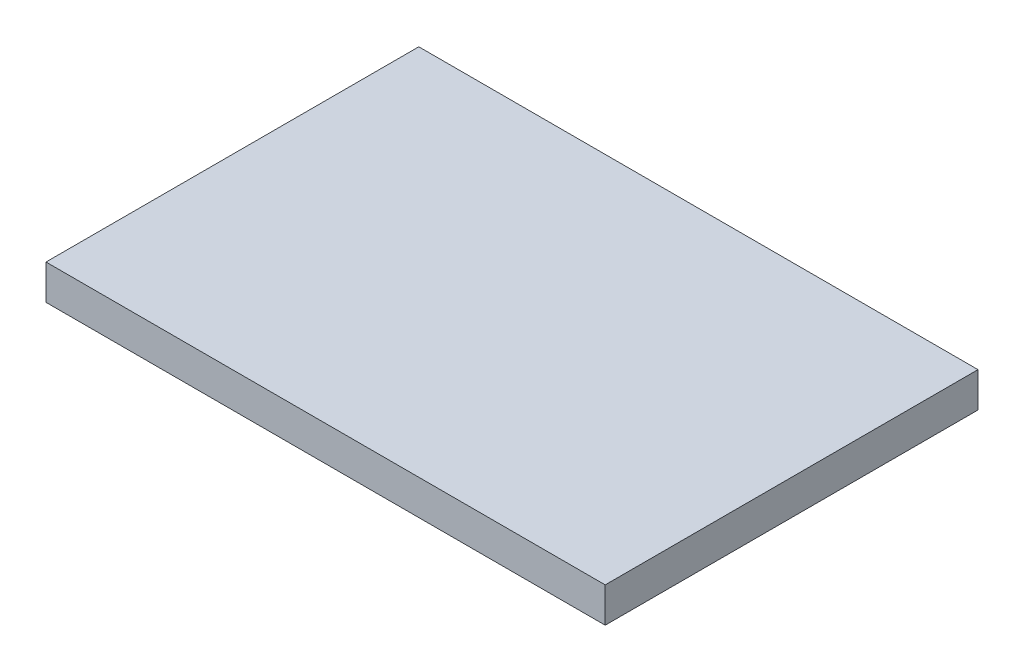
from build123d import *

# Parameters (mm, degrees)
OUTER_SHELL_EXTRUSION_DEPTH   = 9.525
SKETCH2_R                     = 1.5875
INSERTION_HOLES_DEPTH         = 3.175
WALLTHICKNESS_SHELL_START     = -73.025
WALLTHICKNESS_SHELL_OUTLINE_W = 3.175
WALLTHICKNESS_SHELL_OUTLINE_H = 95.25
WALLTHICKNESS_SHELL_DEPTH     = 146.05
CUT_EXTRUDE2_START            = 3.175
CUT_EXTRUDE2_DEPTH            = 3.175
SKETCH3_R                     = 1.27
SKETCH3_R_2                   = 1.905
SKETCH3_R_3                   = 3.175
SKETCH3_R_4                   = 6.35
SKETCH3_R_5                   = 9.525
BOSS_EXTRUDE2_DEPTH           = 3.175
FILLET1_R                     = 1


# Read off the part's stored shape, not the designer's step: WallThickness-Shell, Cut-Extrude2
with BuildPart() as part:
    # Outer_Shell → Outer_Shell_Extrusion (new body)
    with BuildSketch(Plane(origin=(0, 0, 0), x_dir=(1, 0, 0), z_dir=(0, 1, 0))):
        Polygon((66.675, 61.504285714), (76.2, 61.504285714), (76.2, 51.979285714), (76.2, 45.629285714), (76.2, 26.579285714), (76.2, 20.229285714), (76.2, 1.179285714), (76.2, -5.170714286), (76.2, -24.220714286), (76.2, -30.570714286), (76.2, -40.095714286), (66.675, -40.095714286), (60.325, -40.095714286), (41.275, -40.095714286), (34.925, -40.095714286), (15.875, -40.095714286), (9.525, -40.095714286), (-9.525, -40.095714286), (-15.875, -40.095714286), (-76.2, -40.095714286), (-76.2, 61.504285714), (-15.875, 61.504285714), (-9.525, 61.504285714), (9.525, 61.504285714), (15.875, 61.504285714), (34.925, 61.504285714), (41.275, 61.504285714), (60.325, 61.504285714), align=None)
    extrude(amount=OUTER_SHELL_EXTRUSION_DEPTH)

    # Sketch2 → Insertion_holes (cut)
    with BuildSketch(Plane.ZY.offset(76.2)):
        with Locations((-48.804285714, 4.7625)):
            Circle(SKETCH2_R)
        with Locations((-29.754285714, 4.7625)):
            Circle(SKETCH2_R)
        with Locations((-10.704285714, 4.7625)):
            Circle(SKETCH2_R)
        with Locations((8.345714286, 4.7625)):
            Circle(SKETCH2_R)
        with Locations((27.395714286, 4.7625)):
            Circle(SKETCH2_R)
    extrude(amount=-INSERTION_HOLES_DEPTH, mode=Mode.SUBTRACT)

    # WallThickness-Shell outline → WallThickness-Shell (cut)
    with BuildSketch(Plane.YZ.offset(WALLTHICKNESS_SHELL_START)):
        with Locations((4.7625, -10.704285714)):
            Rectangle(WALLTHICKNESS_SHELL_OUTLINE_W, WALLTHICKNESS_SHELL_OUTLINE_H)
    extrude(amount=WALLTHICKNESS_SHELL_DEPTH, mode=Mode.SUBTRACT)

    # Cut-Extrude2 outline → Cut-Extrude2 (cut)
    with BuildSketch(Plane(origin=(0, 0, 0), x_dir=(1, 0, 0), z_dir=(0, 1, 0)).offset(CUT_EXTRUDE2_START)):
        with BuildLine():
            Line((61.9075, 58.329285714), (65.0875, 58.329285714))
            ThreePointArc((65.0875, 58.329285714), (63.4975, 59.919285714), (61.9075, 58.329285714))
        make_face()
        with BuildLine():
            ThreePointArc((-14.3175, -36.920714286), (-12.7275, -38.510714286), (-11.1375, -36.920714286))
            Line((-11.1375, -36.920714286), (-14.3175, -36.920714286))
        make_face()
        with BuildLine():
            ThreePointArc((11.0925, -36.920714286), (12.6825, -38.510714286), (14.2725, -36.920714286))
            Line((14.2725, -36.920714286), (11.0925, -36.920714286))
        make_face()
        with BuildLine():
            ThreePointArc((36.5025, -36.920714286), (38.0925, -38.510714286), (39.6825, -36.920714286))
            Line((39.6825, -36.920714286), (36.5025, -36.920714286))
        make_face()
        with BuildLine():
            ThreePointArc((61.9075, -36.920714286), (63.4975, -38.510714286), (65.0875, -36.920714286))
            Line((65.0875, -36.920714286), (61.9075, -36.920714286))
        make_face()
        with BuildLine():
            ThreePointArc((73.025, -28.985714286), (74.615, -27.395714286), (73.025, -25.805714286))
            Line((73.025, -25.805714286), (73.025, -28.985714286))
        make_face()
        with BuildLine():
            ThreePointArc((73.025, -3.575714286), (74.615, -1.985714286), (73.025, -0.395714286))
            Line((73.025, -0.395714286), (73.025, -3.575714286))
        make_face()
        with BuildLine():
            ThreePointArc((73.025, 21.804285714), (74.615, 23.394285714), (73.025, 24.984285714))
            Line((73.025, 24.984285714), (73.025, 21.804285714))
        make_face()
        with BuildLine():
            ThreePointArc((73.025, 47.214285714), (74.615, 48.804285714), (73.025, 50.394285714))
            Line((73.025, 50.394285714), (73.025, 47.214285714))
        make_face()
        with BuildLine():
            Line((-14.3175, 58.329285714), (-11.1375, 58.329285714))
            ThreePointArc((-11.1375, 58.329285714), (-12.7275, 59.919285714), (-14.3175, 58.329285714))
        make_face()
        with BuildLine():
            Line((11.0925, 58.329285714), (14.2725, 58.329285714))
            ThreePointArc((14.2725, 58.329285714), (12.6825, 59.919285714), (11.0925, 58.329285714))
        make_face()
        with BuildLine():
            Line((36.5025, 58.329285714), (39.6825, 58.329285714))
            ThreePointArc((39.6825, 58.329285714), (38.0925, 59.919285714), (36.5025, 58.329285714))
        make_face()
    extrude(amount=CUT_EXTRUDE2_DEPTH, mode=Mode.SUBTRACT)

    # Sketch3 → Boss-Extrude2 (add)
    with BuildSketch(Plane(origin=(0, 3.175, 0), x_dir=(1, 0, 0), z_dir=(0, 1, 0))):
        with Locations(Location((-57.15, -26.760714286, 0), (0, 0, 270))):
            Circle(SKETCH3_R)
        with Locations(Location((-44.45, -26.760714286, 0), (0, 0, 270))):
            Circle(SKETCH3_R)
        with Locations(Location((-31.75, -26.760714286, 0), (0, 0, 270))):
            Circle(SKETCH3_R)
        with Locations(Location((-19.05, -26.760714286, 0), (0, 0, 270))):
            Circle(SKETCH3_R)
        with Locations(Location((-6.35, -26.760714286, 0), (0, 0, 270))):
            Circle(SKETCH3_R)
        with Locations(Location((6.35, -26.760714286, 0), (0, 0, 270))):
            Circle(SKETCH3_R)
        with Locations(Location((19.05, -26.760714286, 0), (0, 0, 270))):
            Circle(SKETCH3_R)
        with Locations(Location((31.75, -26.760714286, 0), (0, 0, 270))):
            Circle(SKETCH3_R)
        with Locations(Location((44.45, -26.760714286, 0), (0, 0, 270))):
            Circle(SKETCH3_R)
        with Locations(Location((57.15, -26.760714286, 0), (0, 0, 270))):
            Circle(SKETCH3_R)
        with Locations(Location((-57.15, -18.302514286, 0), (0, 0, 270))):
            Circle(SKETCH3_R)
        with Locations(Location((-57.15, -9.844314286, 0), (0, 0, 270))):
            Circle(SKETCH3_R)
        with Locations(Location((-57.15, -1.386114286, 0), (0, 0, 270))):
            Circle(SKETCH3_R)
        with Locations(Location((-57.15, 7.072085714, 0), (0, 0, 270))):
            Circle(SKETCH3_R)
        with Locations(Location((-57.15, 15.530285714, 0), (0, 0, 270))):
            Circle(SKETCH3_R)
        with Locations(Location((-57.15, 23.988485714, 0), (0, 0, 270))):
            Circle(SKETCH3_R)
        with Locations(Location((-57.15, 32.446685714, 0), (0, 0, 270))):
            Circle(SKETCH3_R)
        with Locations(Location((-57.15, 40.904885714, 0), (0, 0, 270))):
            Circle(SKETCH3_R)
        with Locations(Location((-44.45, -18.302514286, 0), (0, 0, 270))):
            Circle(SKETCH3_R_2)
        with Locations(Location((-34.45, -18.302514286, 0), (0, 0, 270))):
            Circle(SKETCH3_R_2)
        with Locations(Location((-24.45, -18.302514286, 0), (0, 0, 270))):
            Circle(SKETCH3_R_2)
        with Locations(Location((-14.45, -18.302514286, 0), (0, 0, 270))):
            Circle(SKETCH3_R_2)
        with Locations(Location((-4.45, -18.302514286, 0), (0, 0, 270))):
            Circle(SKETCH3_R_2)
        with Locations(Location((5.55, -18.302514286, 0), (0, 0, 270))):
            Circle(SKETCH3_R_2)
        with Locations(Location((15.55, -18.302514286, 0), (0, 0, 270))):
            Circle(SKETCH3_R_2)
        with Locations(Location((25.55, -18.302514286, 0), (0, 0, 270))):
            Circle(SKETCH3_R_2)
        with Locations(Location((35.55, -18.302514286, 0), (0, 0, 270))):
            Circle(SKETCH3_R_2)
        with Locations(Location((45.55, -18.302514286, 0), (0, 0, 270))):
            Circle(SKETCH3_R_2)
        with Locations(Location((-34.45, -8.302514286, 0), (0, 0, 270))):
            Circle(SKETCH3_R_2)
        with Locations(Location((-24.45, -8.302514286, 0), (0, 0, 270))):
            Circle(SKETCH3_R_2)
        with Locations(Location((-14.45, -8.302514286, 0), (0, 0, 270))):
            Circle(SKETCH3_R_2)
        with Locations(Location((-4.45, -8.302514286, 0), (0, 0, 270))):
            Circle(SKETCH3_R_2)
        with Locations(Location((-34.45, 1.697485714, 0), (0, 0, 270))):
            Circle(SKETCH3_R_2)
        with Locations(Location((-24.45, 1.697485714, 0), (0, 0, 270))):
            Circle(SKETCH3_R_2)
        with Locations(Location((-14.45, 1.697485714, 0), (0, 0, 270))):
            Circle(SKETCH3_R_2)
        with Locations(Location((-34.45, 11.697485714, 0), (0, 0, 270))):
            Circle(SKETCH3_R_2)
        with Locations(Location((-24.45, 11.697485714, 0), (0, 0, 270))):
            Circle(SKETCH3_R_2)
        with Locations(Location((-34.45, 21.697485714, 0), (0, 0, 270))):
            Circle(SKETCH3_R_2)
        with Locations(Location((-44.45, -8.302514286, 0), (0, 0, 270))):
            Circle(SKETCH3_R_2)
        with Locations(Location((-44.45, 1.697485714, 0), (0, 0, 270))):
            Circle(SKETCH3_R_2)
        with Locations(Location((-44.45, 11.697485714, 0), (0, 0, 270))):
            Circle(SKETCH3_R_2)
        with Locations(Location((-44.45, 21.697485714, 0), (0, 0, 270))):
            Circle(SKETCH3_R_2)
        with Locations(Location((-44.45, 31.697485714, 0), (0, 0, 270))):
            Circle(SKETCH3_R_2)
        with Locations(Location((-44.45, 41.697485714, 0), (0, 0, 270))):
            Circle(SKETCH3_R_2)
        with Locations(Location((-57.15, 50.904885714, 0), (0, 0, 270))):
            Circle(SKETCH3_R)
        with Locations(Location((-44.45, 51.697485714, 0), (0, 0, 270))):
            Circle(SKETCH3_R_2)
        with Locations(Location((55.55, -12.587514286, 0), (0, 0, 270))):
            Circle(SKETCH3_R_3)
        with Locations(Location((5.55, -8.302514286, 0), (0, 0, 270))):
            Circle(SKETCH3_R_3)
        with Locations(Location((15.55, -5.762514286, 0), (0, 0, 270))):
            Circle(SKETCH3_R_3)
        with Locations(Location((25.55, -8.302514286, 0), (0, 0, 270))):
            Circle(SKETCH3_R_3)
        with Locations(Location((35.55, -2.587514286, 0), (0, 0, 270))):
            Circle(SKETCH3_R_3)
        with Locations(Location((45.55, -8.302514286, 0), (0, 0, 270))):
            Circle(SKETCH3_R_3)
        with Locations(Location((55.55, -2.587514286, 0), (0, 0, 270))):
            Circle(SKETCH3_R_3)
        with Locations(Location((-4.45, 7.412485714, 0), (0, 0, 270))):
            Circle(SKETCH3_R_3)
        with Locations(Location((5.55, 1.697485714, 0), (0, 0, 270))):
            Circle(SKETCH3_R_3)
        with Locations(Location((15.55, 7.412485714, 0), (0, 0, 270))):
            Circle(SKETCH3_R_3)
        with Locations(Location((25.55, 1.697485714, 0), (0, 0, 270))):
            Circle(SKETCH3_R_3)
        with Locations(Location((35.55, 7.412485714, 0), (0, 0, 270))):
            Circle(SKETCH3_R_3)
        with Locations(Location((45.55, 1.697485714, 0), (0, 0, 270))):
            Circle(SKETCH3_R_3)
        with Locations(Location((55.55, 7.412485714, 0), (0, 0, 270))):
            Circle(SKETCH3_R_3)
        with Locations(Location((-14.45, 17.412485714, 0), (0, 0, 270))):
            Circle(SKETCH3_R_3)
        with Locations(Location((-4.45, 17.412485714, 0), (0, 0, 270))):
            Circle(SKETCH3_R_3)
        with Locations(Location((-24.45, 27.412485714, 0), (0, 0, 270))):
            Circle(SKETCH3_R_3)
        with Locations(Location((-14.45, 27.412485714, 0), (0, 0, 270))):
            Circle(SKETCH3_R_3)
        with Locations(Location((-34.45, 37.412485714, 0), (0, 0, 270))):
            Circle(SKETCH3_R_3)
        with Locations(Location((-24.45, 37.412485714, 0), (0, 0, 270))):
            Circle(SKETCH3_R_3)
        with Locations(Location((-34.45, 47.412485714, 0), (0, 0, 270))):
            Circle(SKETCH3_R_3)
        with Locations(Location((-6.35, 36.521863747, 0), (0, 0, 270))):
            Circle(SKETCH3_R_4)
        with Locations(Location((11.061190517, 36.521863747, 0), (0, 0, 270))):
            Circle(SKETCH3_R_4)
        with Locations(Location((7.418737671, 19.466006948, 0), (0, 0, 270))):
            Circle(SKETCH3_R_4)
        with Locations(Location((-17.559851695, 47.412485714, 0), (0, 0, 270))):
            Circle(SKETCH3_R_4)
        with Locations(Location((25.55, 19.466006948, 0), (0, 0, 270))):
            Circle(SKETCH3_R_4)
        with Locations(Location((47.318392689, 24.465357868, 0), (0, 0, 270))):
            Circle(SKETCH3_R_5)
        with Locations(Location((29.505110236, 43.291084861, 0), (0, 0, 270))):
            Circle(SKETCH3_R_5)
        with Locations(Location((57.15, 43.291084861, 0), (0, 0, 270))):
            Circle(SKETCH3_R_5)
    extrude(amount=BOSS_EXTRUDE2_DEPTH)

    # Fillet1
    fillet1_edges = [part.edges().sort_by_distance(p)[0] for p in [
        (-57.15, 6.35, 25.490714286),
        (-57.15, 3.175, 25.490714286),
        (-44.45, 6.35, 25.490714286),
        (-44.45, 3.175, 25.490714286),
        (-31.75, 6.35, 25.490714286),
        (-31.75, 3.175, 25.490714286),
        (-19.05, 6.35, 25.490714286),
        (-19.05, 3.175, 25.490714286),
        (-6.35, 6.35, 25.490714286),
        (-6.35, 3.175, 25.490714286),
        (6.35, 6.35, 25.490714286),
        (6.35, 3.175, 25.490714286),
        (19.05, 6.35, 25.490714286),
        (19.05, 3.175, 25.490714286),
        (31.75, 6.35, 25.490714286),
        (31.75, 3.175, 25.490714286),
        (44.45, 6.35, 25.490714286),
        (44.45, 3.175, 25.490714286),
        (57.15, 6.35, 25.490714286),
        (57.15, 3.175, 25.490714286),
        (-44.45, 3.175, 16.397514286),
        (-57.15, 6.35, 17.032514286),
        (-57.15, 3.175, 17.032514286),
        (-57.15, 6.35, 8.574314286),
        (-57.15, 3.175, 8.574314286),
        (-57.15, 6.35, 0.116114286),
        (-57.15, 3.175, 0.116114286),
        (-57.15, 6.35, -8.342085714),
        (-57.15, 3.175, -8.342085714),
        (-57.15, 6.35, -16.800285714),
        (-57.15, 3.175, -16.800285714),
        (-57.15, 6.35, -25.258485714),
        (-57.15, 3.175, -25.258485714),
        (-57.15, 6.35, -33.716685714),
        (-57.15, 3.175, -33.716685714),
        (-57.15, 6.35, -42.174885714),
        (-57.15, 3.175, -42.174885714),
        (-6.35, 6.35, -42.871863747),
        (-6.35, 3.175, -42.871863747),
        (-34.45, 6.35, 16.397514286),
        (-34.45, 3.175, 16.397514286),
        (-24.45, 6.35, 16.397514286),
        (-24.45, 3.175, 16.397514286),
        (-14.45, 6.35, 16.397514286),
        (-14.45, 3.175, 16.397514286),
        (-4.45, 6.35, 16.397514286),
        (-4.45, 3.175, 16.397514286),
        (5.55, 6.35, 16.397514286),
        (5.55, 3.175, 16.397514286),
        (15.55, 6.35, 16.397514286),
        (15.55, 3.175, 16.397514286),
        (25.55, 6.35, 16.397514286),
        (25.55, 3.175, 16.397514286),
        (35.55, 6.35, 16.397514286),
        (35.55, 3.175, 16.397514286),
        (45.55, 6.35, 16.397514286),
        (45.55, 3.175, 16.397514286),
        (-34.45, 6.35, 6.397514286),
        (-34.45, 3.175, 6.397514286),
        (-24.45, 6.35, 6.397514286),
        (-24.45, 3.175, 6.397514286),
        (-14.45, 6.35, 6.397514286),
        (-14.45, 3.175, 6.397514286),
        (-4.45, 6.35, 6.397514286),
        (-4.45, 3.175, 6.397514286),
        (-34.45, 6.35, -3.602485714),
        (-34.45, 3.175, -3.602485714),
        (-24.45, 6.35, -3.602485714),
        (-24.45, 3.175, -3.602485714),
        (-14.45, 6.35, -3.602485714),
        (-14.45, 3.175, -3.602485714),
        (-34.45, 6.35, -13.602485714),
        (-34.45, 3.175, -13.602485714),
        (-24.45, 6.35, -13.602485714),
        (-24.45, 3.175, -13.602485714),
        (-34.45, 6.35, -23.602485714),
        (-34.45, 3.175, -23.602485714),
        (-44.45, 6.35, 6.397514286),
        (-44.45, 3.175, 6.397514286),
        (-44.45, 6.35, -3.602485714),
        (-44.45, 3.175, -3.602485714),
        (-44.45, 6.35, -13.602485714),
        (-44.45, 3.175, -13.602485714),
        (-44.45, 6.35, -23.602485714),
        (-44.45, 3.175, -23.602485714),
        (-44.45, 6.35, -33.602485714),
        (-44.45, 3.175, -33.602485714),
        (-44.45, 6.35, -43.602485714),
        (-44.45, 3.175, -43.602485714),
        (-57.15, 6.35, -52.174885714),
        (-57.15, 3.175, -52.174885714),
        (-44.45, 6.35, -53.602485714),
        (-44.45, 3.175, -53.602485714),
        (55.55, 6.35, 9.412514286),
        (55.55, 3.175, 9.412514286),
        (5.55, 3.175, 5.127514286),
        (15.55, 6.35, 2.587514286),
        (15.55, 3.175, 2.587514286),
        (25.55, 6.35, 5.127514286),
        (25.55, 3.175, 5.127514286),
        (35.55, 6.35, -0.587485714),
        (35.55, 3.175, -0.587485714),
        (45.55, 6.35, 5.127514286),
        (45.55, 3.175, 5.127514286),
        (55.55, 6.35, -0.587485714),
        (55.55, 3.175, -0.587485714),
        (-4.45, 6.35, -10.587485714),
        (-4.45, 3.175, -10.587485714),
        (5.55, 6.35, -4.872485714),
        (5.55, 3.175, -4.872485714),
        (15.55, 6.35, -10.587485714),
        (15.55, 3.175, -10.587485714),
        (25.55, 6.35, -4.872485714),
        (25.55, 3.175, -4.872485714),
        (35.55, 6.35, -10.587485714),
        (35.55, 3.175, -10.587485714),
        (45.55, 6.35, -4.872485714),
        (45.55, 3.175, -4.872485714),
        (55.55, 6.35, -10.587485714),
        (55.55, 3.175, -10.587485714),
        (-14.45, 3.175, -20.587485714),
        (-4.45, 6.35, -20.587485714),
        (-4.45, 3.175, -20.587485714),
        (-24.45, 6.35, -30.587485714),
        (-24.45, 3.175, -30.587485714),
        (-14.45, 6.35, -30.587485714),
        (-14.45, 3.175, -30.587485714),
        (-34.45, 6.35, -40.587485714),
        (-34.45, 3.175, -40.587485714),
        (-24.45, 6.35, -40.587485714),
        (-24.45, 3.175, -40.587485714),
        (-34.45, 6.35, -50.587485714),
        (-34.45, 3.175, -50.587485714),
        (11.061190517, 6.35, -42.871863747),
        (11.061190517, 3.175, -42.871863747),
        (7.418737671, 6.35, -25.816006948),
        (7.418737671, 3.175, -25.816006948),
        (-17.559851695, 6.35, -53.762485714),
        (-17.559851695, 3.175, -53.762485714),
        (25.55, 6.35, -25.816006948),
        (25.55, 3.175, -25.816006948),
        (47.318392689, 6.35, -33.990357868),
        (47.318392689, 3.175, -33.990357868),
        (29.505110236, 6.35, -52.816084861),
        (29.505110236, 3.175, -52.816084861),
        (57.15, 6.35, -52.816084861),
        (57.15, 3.175, -52.816084861),
    ]]
    fillet(fillet1_edges, radius=FILLET1_R)


solid = part.part
